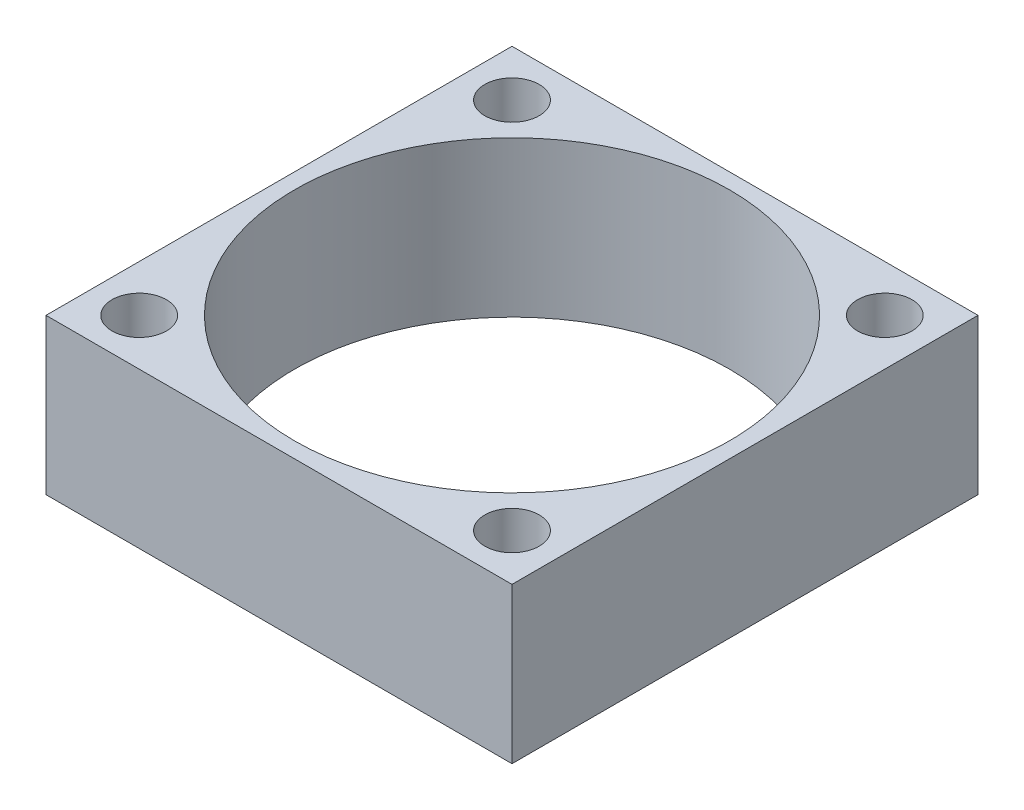
from build123d import *

# Parameters (mm, degrees)
SKETCH_1_W              = 30
SKETCH_1_H              = 30
SKETCH_1_R              = 14
EXTRUDE_1_DEPTH         = 10
HOLE_WIZARD_3_5_3_5_1_D = 3.5


with BuildPart() as part:
    # Эскиз1 → Бобышка-Вытянуть1 (new body)
    with BuildSketch(Plane(origin=(0, 0, 0), x_dir=(1, 0, 0), z_dir=(0, 1, 0))):
        with Locations((15, 15)):
            Rectangle(SKETCH_1_W, SKETCH_1_H)
        with Locations((15, 15)):
            Circle(SKETCH_1_R, mode=Mode.SUBTRACT)
    extrude(amount=EXTRUDE_1_DEPTH)

    # Диаметр отверстия Ø3.5 (3.5)1 (through all)
    with Locations(Plane(origin=(0, 10, 0), x_dir=(1, 0, 0), z_dir=(0, 1, 0))):
        with Locations((3, 27), (27, 27), (27, 3), (3, 3)):
            Hole(HOLE_WIZARD_3_5_3_5_1_D / 2)


solid = part.part
